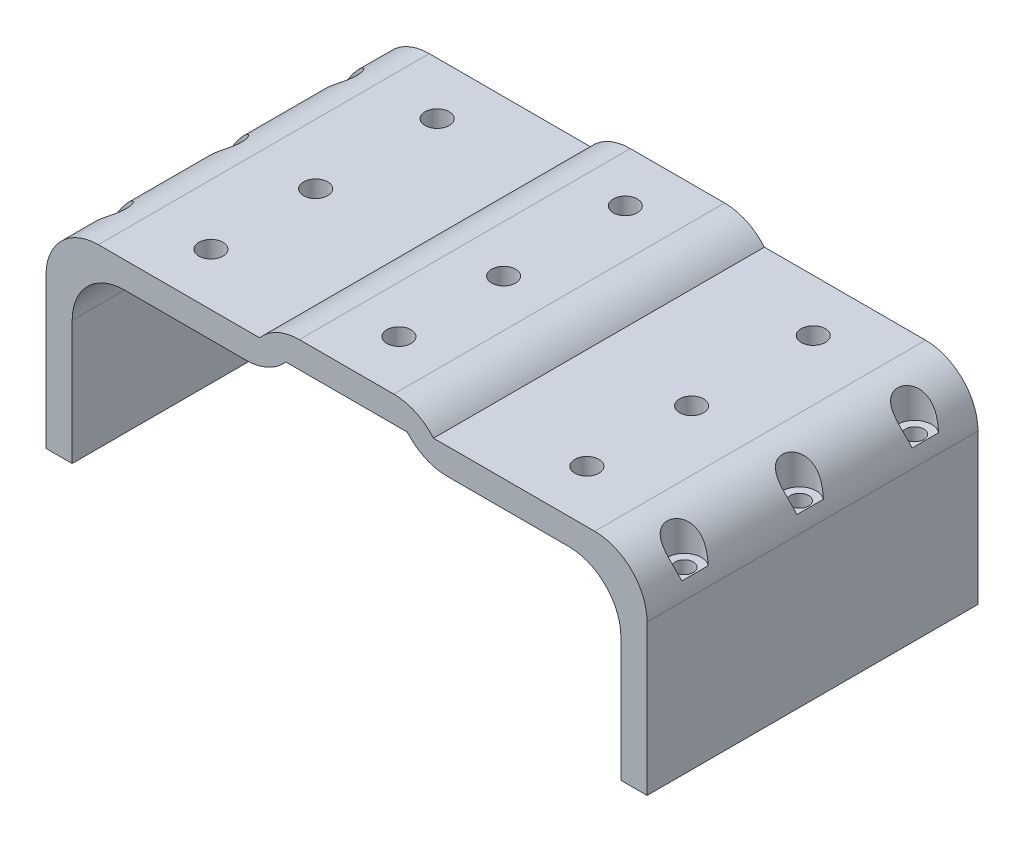
from build123d import *

# Parameters (mm, degrees)
BOSS_EXTRUDE1_DEPTH = 63.2
FILLET1_R           = 10
FILLET2_R           = 10
FILLET3_R           = 10
CUT_EXTRUDE1_REACH  = 139.674
SKETCH2_R           = 2.3
SKETCH3_R           = 1.75
CUT_EXTRUDE2_DEPTH  = 138.67396268
SKETCH4_R           = 3.25
CUT_EXTRUDE3_DEPTH  = 7


with BuildPart() as part:
    # Sketch1 → Boss-Extrude1 (new body)
    with BuildSketch(Plane.XY):
        Polygon((114.8, 0), (114.8, 22.5), (92.3, 22.5), (74.008186766, 22.5), (74.008186766, 26), (40.791813234, 26), (40.791813234, 22.5), (22.5, 22.5), (0, 22.5), (0, 0), (0, -16.2), (5, -16.2), (5, 0), (5, 17.5), (22.5, 17.5), (45.791813234, 17.5), (45.791813234, 21), (57.4, 21), (69.008186766, 21), (69.008186766, 17.5), (92.3, 17.5), (109.8, 17.5), (109.8, 0), (109.8, -16.2), (114.8, -16.2), align=None)
    extrude(amount=BOSS_EXTRUDE1_DEPTH)

    # Fillet1
    fillet1_edges = [part.edges().sort_by_distance(p)[0] for p in [
        (0, 22.5, 31.6),
        (114.8, 22.5, 31.6),
        (109.8, 17.5, 31.6),
        (5, 17.5, 31.6),
    ]]
    fillet(fillet1_edges, radius=FILLET1_R)

    # Fillet2
    # the kernel refuses this fillet: 10 mm, written as the material it takes off along each edge
    with BuildSketch(Plane(origin=(40.791813234, 26, -18.998355192), x_dir=(1, 0, 0), z_dir=(0, 0, 1))) as fillet2_piece_1:
        with BuildLine():
            CenterArc((7.599342077, -10), FILLET2_R, 90, 49.458398126)
            Line((0, -3.5), (-0.151986842, -3.37))
            ThreePointArc((-0.151986842, -3.37), (-0.2, -1.75), (-0.2, 0))
            Line((-0.2, 0), (0, 0.2))
            Line((0, 0.2), (7.599342077, 0.2))
            Line((7.599342077, 0.2), (7.599342077, 0))
        make_face()
    extrude(amount=101.196710384, mode=Mode.SUBTRACT)
    with BuildSketch(Plane(origin=(74.008186766, 26, -18.998355192), x_dir=(0, -1, 0), z_dir=(0, 0, 1))) as fillet2_piece_2:
        with BuildLine():
            CenterArc((10, -7.599342077), FILLET2_R, 130.541601874, 49.458398126)
            Line((0, -7.599342077), (-0.2, -7.599342077))
            Line((-0.2, -7.599342077), (-0.2, 0))
            Line((-0.2, 0), (0, 0.2))
            ThreePointArc((0, 0.2), (1.75, 0.2), (3.37, 0.151986842))
            Line((3.37, 0.151986842), (3.5, 0))
        make_face()
    extrude(amount=101.196710384, mode=Mode.SUBTRACT)

    # Fillet3
    # the kernel refuses this fillet: 10 mm, written as the material it takes off along each edge
    with BuildSketch(Plane(origin=(45.791813234, 17.5, -18.998355192), x_dir=(0, 1, 0), z_dir=(0, 0, 1))) as fillet3_piece_1:
        with BuildLine():
            CenterArc((10, 7.599342077), FILLET3_R, 180, 49.458398126)
            Line((0, 7.599342077), (-0.2, 7.599342077))
            Line((-0.2, 7.599342077), (-0.2, 0))
            Line((-0.2, 0), (0, -0.2))
            ThreePointArc((0, -0.2), (1.75, -0.2), (3.37, -0.151986842))
            Line((3.37, -0.151986842), (3.5, 0))
        make_face()
    extrude(amount=101.196710384, mode=Mode.SUBTRACT)
    with BuildSketch(Plane(origin=(69.008186766, 17.5, -18.998355192), x_dir=(1, 0, 0), z_dir=(0, 0, 1))) as fillet3_piece_2:
        with BuildLine():
            CenterArc((7.599342077, 10), FILLET3_R, 220.541601874, 49.458398126)
            Line((0, 3.5), (-0.151986842, 3.37))
            ThreePointArc((-0.151986842, 3.37), (-0.2, 1.75), (-0.2, 0))
            Line((-0.2, 0), (0, -0.2))
            Line((0, -0.2), (7.599342077, -0.2))
            Line((7.599342077, -0.2), (7.599342077, 0))
        make_face()
    extrude(amount=101.196710384, mode=Mode.SUBTRACT)

    # Sketch2 → Cut-Extrude1 (cut, up to next)
    with BuildSketch(Plane(origin=(0, 26, 0), x_dir=(1, 0, 0), z_dir=(0, 1, 0)), mode=Mode.PRIVATE) as cut_extrude1_sk1:
        with Locations(Location((57.4, -9.964206912, 0), (0, 0, 270))):
            Circle(SKETCH2_R)
    cut_extrude1_tool1 = extrude(cut_extrude1_sk1.sketch, amount=-CUT_EXTRUDE1_REACH, mode=Mode.PRIVATE) & part.part
    # Sketch2 → Cut-Extrude1 (cut, up to next)
    with BuildSketch(Plane(origin=(0, 26, 0), x_dir=(1, 0, 0), z_dir=(0, 1, 0)), mode=Mode.PRIVATE) as cut_extrude1_sk2:
        with Locations(Location((57.4, -33.2, 0), (0, 0, 270))):
            Circle(SKETCH2_R)
    cut_extrude1_tool2 = extrude(cut_extrude1_sk2.sketch, amount=-CUT_EXTRUDE1_REACH, mode=Mode.PRIVATE) & part.part
    # Sketch2 → Cut-Extrude1 (cut, up to next)
    with BuildSketch(Plane(origin=(0, 26, 0), x_dir=(1, 0, 0), z_dir=(0, 1, 0)), mode=Mode.PRIVATE) as cut_extrude1_sk3:
        with Locations(Location((57.4, -53.2, 0), (0, 0, 270))):
            Circle(SKETCH2_R)
    cut_extrude1_tool3 = extrude(cut_extrude1_sk3.sketch, amount=-CUT_EXTRUDE1_REACH, mode=Mode.PRIVATE) & part.part
    # Sketch2 → Cut-Extrude1 (cut, up to next)
    with BuildSketch(Plane(origin=(0, 26, 0), x_dir=(1, 0, 0), z_dir=(0, 1, 0)), mode=Mode.PRIVATE) as cut_extrude1_sk4:
        with Locations(Location((21.5, -10, 0), (0, 0, 270))):
            Circle(SKETCH2_R)
    cut_extrude1_tool4 = extrude(cut_extrude1_sk4.sketch, amount=-CUT_EXTRUDE1_REACH, mode=Mode.PRIVATE) & part.part
    # Sketch2 → Cut-Extrude1 (cut, up to next)
    with BuildSketch(Plane(origin=(0, 26, 0), x_dir=(1, 0, 0), z_dir=(0, 1, 0)), mode=Mode.PRIVATE) as cut_extrude1_sk5:
        with Locations(Location((93.3, -9.964206912, 0), (0, 0, 270))):
            Circle(SKETCH2_R)
    cut_extrude1_tool5 = extrude(cut_extrude1_sk5.sketch, amount=-CUT_EXTRUDE1_REACH, mode=Mode.PRIVATE) & part.part
    # Sketch2 → Cut-Extrude1 (cut, up to next)
    with BuildSketch(Plane(origin=(0, 26, 0), x_dir=(1, 0, 0), z_dir=(0, 1, 0)), mode=Mode.PRIVATE) as cut_extrude1_sk6:
        with Locations(Location((93.3, -33.2, 0), (0, 0, 270))):
            Circle(SKETCH2_R)
    cut_extrude1_tool6 = extrude(cut_extrude1_sk6.sketch, amount=-CUT_EXTRUDE1_REACH, mode=Mode.PRIVATE) & part.part
    # Sketch2 → Cut-Extrude1 (cut, up to next)
    with BuildSketch(Plane(origin=(0, 26, 0), x_dir=(1, 0, 0), z_dir=(0, 1, 0)), mode=Mode.PRIVATE) as cut_extrude1_sk7:
        with Locations(Location((93.3, -53.2, 0), (0, 0, 270))):
            Circle(SKETCH2_R)
    cut_extrude1_tool7 = extrude(cut_extrude1_sk7.sketch, amount=-CUT_EXTRUDE1_REACH, mode=Mode.PRIVATE) & part.part
    # Sketch2 → Cut-Extrude1 (cut, up to next)
    with BuildSketch(Plane(origin=(0, 26, 0), x_dir=(1, 0, 0), z_dir=(0, 1, 0)), mode=Mode.PRIVATE) as cut_extrude1_sk8:
        with Locations(Location((21.5, -53.2, 0), (0, 0, 270))):
            Circle(SKETCH2_R)
    cut_extrude1_tool8 = extrude(cut_extrude1_sk8.sketch, amount=-CUT_EXTRUDE1_REACH, mode=Mode.PRIVATE) & part.part
    # Sketch2 → Cut-Extrude1 (cut, up to next)
    with BuildSketch(Plane(origin=(0, 26, 0), x_dir=(1, 0, 0), z_dir=(0, 1, 0)), mode=Mode.PRIVATE) as cut_extrude1_sk9:
        with Locations(Location((21.5, -33.2, 0), (0, 0, 270))):
            Circle(SKETCH2_R)
    cut_extrude1_tool9 = extrude(cut_extrude1_sk9.sketch, amount=-CUT_EXTRUDE1_REACH, mode=Mode.PRIVATE) & part.part
    add(cut_extrude1_tool1.solids().sort_by_distance((57.4, 26, 9.964207))[0], mode=Mode.SUBTRACT)
    add(cut_extrude1_tool2.solids().sort_by_distance((57.4, 26, 33.2))[0], mode=Mode.SUBTRACT)
    add(cut_extrude1_tool3.solids().sort_by_distance((57.4, 26, 53.2))[0], mode=Mode.SUBTRACT)
    add(cut_extrude1_tool4.solids().sort_by_distance((21.5, 26, 10))[0], mode=Mode.SUBTRACT)
    add(cut_extrude1_tool5.solids().sort_by_distance((93.3, 26, 9.964207))[0], mode=Mode.SUBTRACT)
    add(cut_extrude1_tool6.solids().sort_by_distance((93.3, 26, 33.2))[0], mode=Mode.SUBTRACT)
    add(cut_extrude1_tool7.solids().sort_by_distance((93.3, 26, 53.2))[0], mode=Mode.SUBTRACT)
    add(cut_extrude1_tool8.solids().sort_by_distance((21.5, 26, 53.2))[0], mode=Mode.SUBTRACT)
    add(cut_extrude1_tool9.solids().sort_by_distance((21.5, 26, 33.2))[0], mode=Mode.SUBTRACT)

    # Sketch3 → Cut-Extrude2 (cut, through all)
    with BuildSketch(Plane.XZ.offset(16.2)):
        with Locations((2.5, 31.6)):
            Circle(SKETCH3_R)
        with Locations((2.5, 53.6)):
            Circle(SKETCH3_R)
        with Locations((2.5, 9.6)):
            Circle(SKETCH3_R)
        with Locations((112.3, 9.6)):
            Circle(SKETCH3_R)
        with Locations((112.3, 53.6)):
            Circle(SKETCH3_R)
        with Locations((112.3, 31.6)):
            Circle(SKETCH3_R)
    extrude(amount=-CUT_EXTRUDE2_DEPTH, mode=Mode.SUBTRACT)

    # Sketch4 → Cut-Extrude3 (cut)
    with BuildSketch(Plane(origin=(0, 22.5, 0), x_dir=(1, 0, 0), z_dir=(0, 1, 0))):
        with Locations((2.5, -9.6)):
            Circle(SKETCH4_R)
        with Locations((2.5, -31.6)):
            Circle(SKETCH4_R)
        with Locations((2.5, -53.6)):
            Circle(SKETCH4_R)
        with Locations((112.3, -53.6)):
            Circle(SKETCH4_R)
        with Locations((112.3, -31.6)):
            Circle(SKETCH4_R)
        with Locations((112.3, -9.6)):
            Circle(SKETCH4_R)
    extrude(amount=-CUT_EXTRUDE3_DEPTH, mode=Mode.SUBTRACT)


solid = part.part
